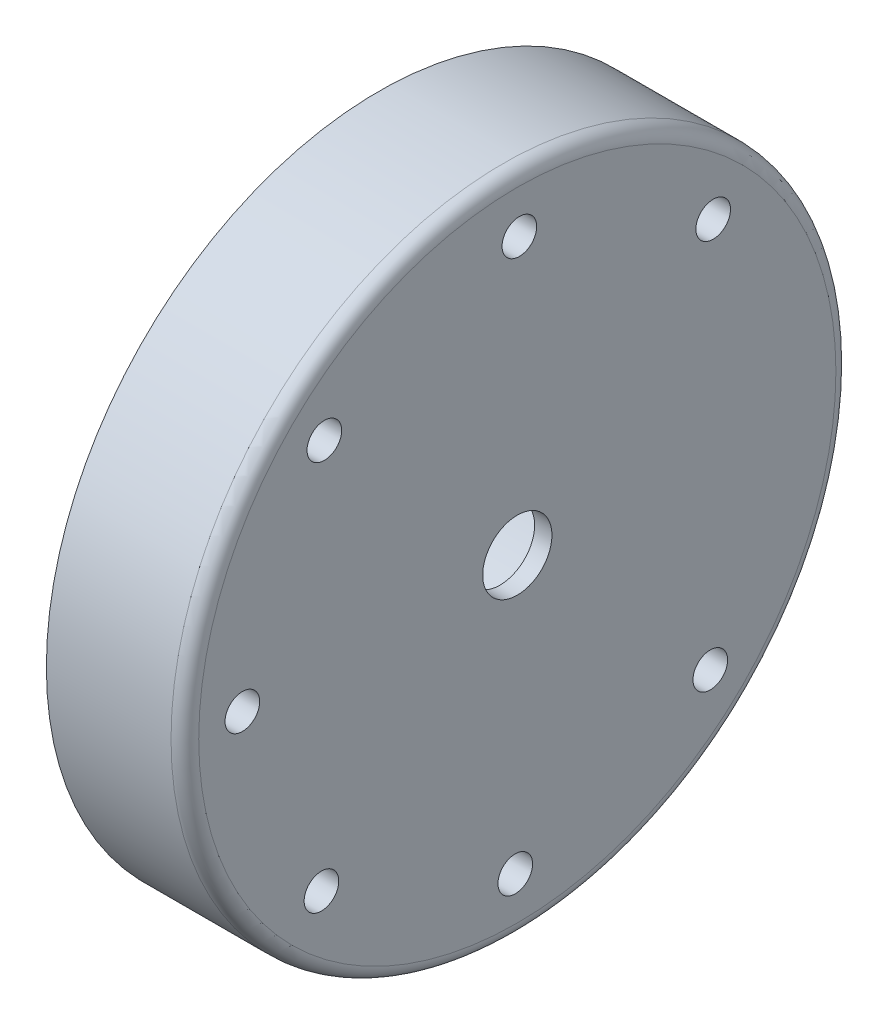
from build123d import *

# Parameters (mm, degrees)
SKETCH1_R           = 60.96
BOSS_EXTRUDE1_DEPTH = 25.4
FILLET1_R           = 2.54
SKETCH2_R           = 4.508
CUT_EXTRUDE1_DEPTH  = 6.35
SKETCH4_R           = 25.019
CUT_EXTRUDE3_DEPTH  = 90.874374546
SKETCH5_R           = 3.175
CUT_EXTRUDE4_DEPTH  = 90.874374546
CIRPATTERN2_COUNT   = 8
SKETCH6_R           = 25.019
SKETCH6_R_2         = 6.35
BOSS_EXTRUDE2_DEPTH = 6.35
SKETCH7_R           = 21.844
CUT_EXTRUDE5_DEPTH  = 3.175


with BuildPart() as part:
    # Sketch1 → Boss-Extrude1 (new body)
    with BuildSketch(Plane(origin=(0, 0, 0), x_dir=(0, 0, -1), z_dir=(1, 0, 0))):
        Circle(SKETCH1_R)
    extrude(amount=BOSS_EXTRUDE1_DEPTH)

    # Fillet1
    fillet1_edges = [part.edges().sort_by_distance(p)[0] for p in [
        (25.4, 0, 60.96),
    ]]
    fillet(fillet1_edges, radius=FILLET1_R)

    # Sketch2 → Cut-Extrude1 (cut)
    with BuildSketch(Plane(origin=(25.4, 0, 0), x_dir=(0, 0, -1), z_dir=(1, 0, 0))):
        Circle(SKETCH2_R)
    extrude(amount=-CUT_EXTRUDE1_DEPTH, mode=Mode.SUBTRACT)

    # Sketch4 → Cut-Extrude3 (cut, through all)
    with BuildSketch(Plane(origin=(25.4, 0, 0), x_dir=(0, 0, -1), z_dir=(1, 0, 0))):
        Circle(SKETCH4_R)
    extrude(amount=-CUT_EXTRUDE3_DEPTH, mode=Mode.SUBTRACT)

    # Sketch5 → Cut-Extrude4 (cut, through all)
    with BuildSketch(Plane.ZY):
        with Locations((-35.91734849, 35.383889532)):
            Circle(SKETCH5_R)
    cut_extrude4 = extrude(amount=-CUT_EXTRUDE4_DEPTH, mode=Mode.SUBTRACT)

    # CirPattern2: Cut-Extrude4 ×8 about axis, 1 skipped
    cirpattern2_axis = Axis((25.4, 0, 0), (1, 0, 0))
    add([cut_extrude4.rotate(cirpattern2_axis, i * 360 / CIRPATTERN2_COUNT) for i in range(1, CIRPATTERN2_COUNT) if i not in (7,)], mode=Mode.SUBTRACT)

    # Sketch6 → Boss-Extrude2 (add)
    with BuildSketch(Plane(origin=(25.4, 0, 0), x_dir=(0, 0, -1), z_dir=(1, 0, 0))):
        Circle(SKETCH6_R)
        Circle(SKETCH6_R_2, mode=Mode.SUBTRACT)
    extrude(amount=-BOSS_EXTRUDE2_DEPTH)

    # Sketch7 → Cut-Extrude5 (cut)
    with BuildSketch(Plane.ZY.offset(-19.05)):
        Circle(SKETCH7_R)
    extrude(amount=-CUT_EXTRUDE5_DEPTH, mode=Mode.SUBTRACT)


solid = part.part
